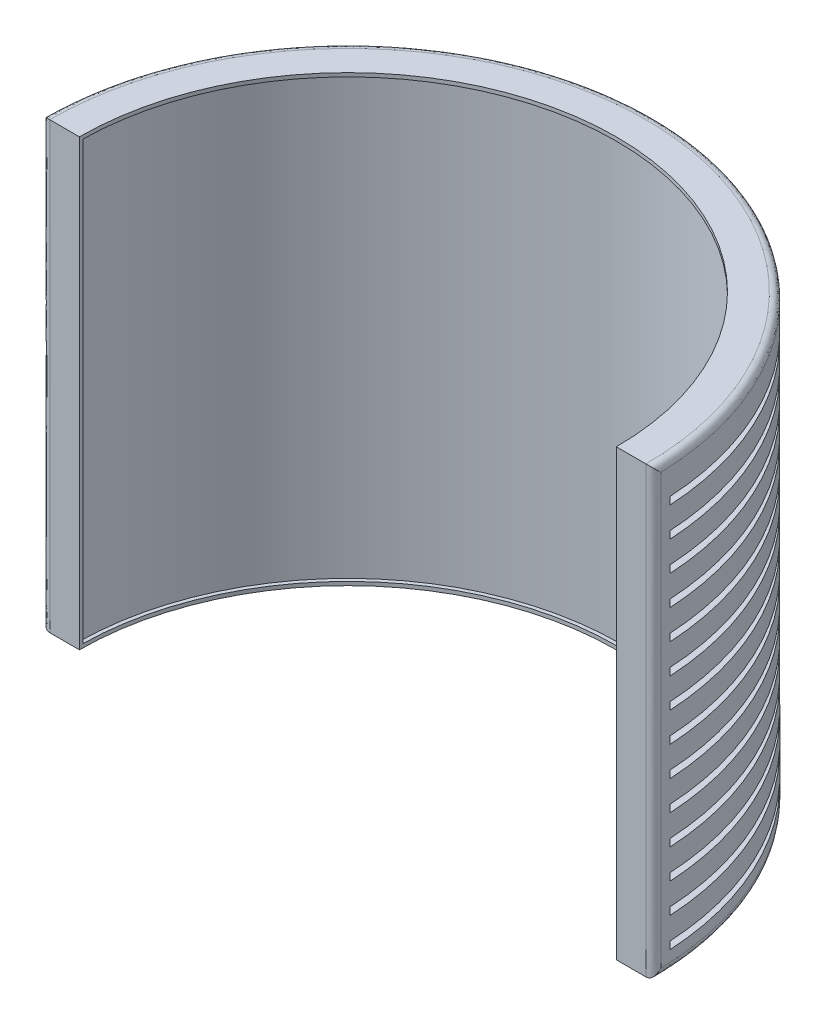
from build123d import *

# Parameters (mm, degrees)
BOSS_EXTRUDE1_DEPTH                     = 304.8
CUT_EXTRUDE1_DEPTH                      = 299.72
CUT_EXTRUDE2_DEPTH                      = 5.08
LPATTERN1_COUNT                         = 10
LPATTERN1_PITCH                         = 20.32
LPATTERN1_COUNT_DIR2                    = 10
LPATTERN1_PITCH_DIR2                    = 20.32
FILLET1_SIZE                            = 5.08
F_8_0_25_DIAMETER_HOLE1_D               = 6.35
F_8_0_25_DIAMETER_HOLE1_DEPTH           = 14.732
F_8_0_25_DIAMETER_HOLE1_TIP             = 1.907732465
F_8_0_25_DIAMETER_HOLE1_ON_FACE_2_D     = 6.35
F_8_0_25_DIAMETER_HOLE1_ON_FACE_2_DEPTH = 14.732
F_8_0_25_DIAMETER_HOLE1_ON_FACE_2_TIP   = 1.907732465


with BuildPart() as part:
    # Sketch1 → Boss-Extrude1 (new body)
    with BuildSketch(Plane(origin=(0, 0, 0), x_dir=(1, 0, 0), z_dir=(0, 1, 0))):
        with BuildLine():
            Line((-209.55, 0), (-184.15, 0))
            ThreePointArc((-184.15, 0), (0, 184.15), (184.15, 0))
            Line((184.15, 0), (209.55, 0))
            ThreePointArc((209.55, 0), (0, 209.55), (-209.55, 0))
        make_face()
    extrude(amount=-BOSS_EXTRUDE1_DEPTH)

    # Sketch5 → Cut-Extrude1 (cut)
    with BuildSketch(Plane(origin=(0, -2.54, 0), x_dir=(1, 0, 0), z_dir=(0, 1, 0))):
        with BuildLine():
            Line((-184.132481925, 2.54), (-186.672720289, 2.54))
            ThreePointArc((-186.672720289, 2.54), (0, 186.69), (186.672720289, 2.54))
            Line((186.672720289, 2.54), (184.132481925, 2.54))
            ThreePointArc((184.132481925, 2.54), (0, 184.15), (-184.132481925, 2.54))
        make_face()
    extrude(amount=-CUT_EXTRUDE1_DEPTH, mode=Mode.SUBTRACT)

    # Sketch9 → Cut-Extrude2 (cut)
    with BuildSketch(Plane(origin=(0, -22.86, 0), x_dir=(1, 0, 0), z_dir=(0, 1, 0))):
        with BuildLine():
            Line((-134.839981703, 150.312688202), (-140.285338085, 155.663825015))
            ThreePointArc((-140.285338085, 155.663825015), (-78.942662192, 194.111459183), (-8.177563934, 209.390376923))
            Line((-8.177563934, 209.390376923), (-8.111036028, 201.767033964))
            ThreePointArc((-8.111036028, 201.767033964), (-75.96470096, 187.096470058), (-134.839981703, 150.312688202))
        make_face()
        with BuildLine():
            Line((9.180878189, 201.721184747), (9.047636671, 209.354586218))
            ThreePointArc((9.047636671, 209.354586218), (79.748630782, 193.781728727), (140.931003892, 155.07951071))
            Line((140.931003892, 155.07951071), (135.635183246, 149.595527894))
            ThreePointArc((135.635183246, 149.595527894), (76.955792101, 186.691003967), (9.180878189, 201.721184747))
        make_face()
        with BuildLine():
            Line((147.936512687, 137.442763048), (153.191799923, 142.98068029))
            ThreePointArc((153.191799923, 142.98068029), (192.704155642, 82.318350922), (209.215767585, 11.830684413))
            Line((209.215767585, 11.830684413), (201.59474677, 11.63112096))
            ThreePointArc((201.59474677, 11.63112096), (185.742207523, 79.218414807), (147.936512687, 137.442763048))
        make_face()
        with BuildLine():
            Line((-201.530233216, 12.7), (-209.164797468, 12.7))
            ThreePointArc((-209.164797468, 12.7), (-192.360409314, 83.118442169), (-152.59630619, 143.616050069))
            Line((-152.59630619, 143.616050069), (-147.205583425, 138.225327304))
            ThreePointArc((-147.205583425, 138.225327304), (-185.319506261, 80.202278641), (-201.530233216, 12.7))
        make_face()
    cut_extrude2 = extrude(amount=-CUT_EXTRUDE2_DEPTH, mode=Mode.SUBTRACT)

    # LPattern1: Cut-Extrude2 10 × 10
    with Locations(*[Vector(0, -1, 0) * (i * LPATTERN1_PITCH) + Vector(0, -1, 0) * (j * LPATTERN1_PITCH_DIR2) for i in range(LPATTERN1_COUNT) for j in range(LPATTERN1_COUNT_DIR2) if (i, j) != (0, 0)]):
        add(cut_extrude2, mode=Mode.SUBTRACT)

    # Fillet1
    # a fillet whose section is not a circle: 5.08 mm, written as the material it takes off along each edge
    with BuildSketch(Plane(origin=(-209.55, 13.016532467, 0), x_dir=(0.012423318985848445, 0, -0.9999228275948979), z_dir=(0, -1, 0))) as fillet1_piece_1:
        with BuildLine():
            Bezier((5.206612987, 0), (-0.000803831, -0.064698393), (0.063894562, 5.142718425), weights=[1, 1, 1])
            Line((0.063894562, 5.142718425), (0, 0))
            ThreePointArc((0, 0), (2.603306493, -0.016171477), (5.206612987, 0))
        make_face()
    extrude(amount=330.833064935, mode=Mode.SUBTRACT)
    with BuildSketch(Plane(origin=(209.55, 13.016532467, 0), x_dir=(-1, 0, 0), z_dir=(0, -1, 0))) as fillet1_piece_2:
        with BuildLine():
            Bezier((5.143115331, 0), (-0.064703386, 0), (0.064683414, 5.20621118), weights=[1, 1, 1])
            ThreePointArc((0.064683414, 5.20621118), (0.016171477, 2.603306493), (0, 0))
            Line((0, 0), (5.143115331, 0))
        make_face()
    extrude(amount=330.833064935, mode=Mode.SUBTRACT)
    with BuildSketch(Plane(origin=(0, -304.8, 0), x_dir=(0.9981581066348997, 0, 0.060666252225040095), z_dir=(-0.060666252225040095, 0, 0.9981581066348997))) as fillet1_piece_3:
        with BuildLine():
            Bezier((209.55, FILLET1_SIZE), (209.55, 0), (209.55 - FILLET1_SIZE, 0), weights=[1, 1, 1])
            Line((209.55 - FILLET1_SIZE, 0), (209.55, 0))
            Line((209.55, 0), (209.55, FILLET1_SIZE))
        make_face()
    revolve(axis=Axis((0, -304.8, 0), (0, 1, 0)), revolution_arc=186.956111753, mode=Mode.SUBTRACT)
    with BuildSketch(Plane(origin=(0, 0, 0), x_dir=(0.9981581066348997, 0, 0.060666252225040095), z_dir=(-0.060666252225040095, 0, 0.9981581066348997))) as fillet1_piece_4:
        with BuildLine():
            Bezier((209.55, -FILLET1_SIZE), (209.55, 0), (209.55 - FILLET1_SIZE, 0), weights=[1, 1, 1])
            Line((209.55 - FILLET1_SIZE, 0), (209.55, 0))
            Line((209.55, 0), (209.55, -FILLET1_SIZE))
        make_face()
    revolve(axis=Axis((0, 0, 0), (0, 1, 0)), revolution_arc=186.956111753, mode=Mode.SUBTRACT)

    # #8 (0.25) Diameter Hole1
    with Locations(Plane(origin=(0.413838607, -292.129588944, -209.549591356), x_dir=(-0.999998049899, 0, -0.001974891947), z_dir=(0.001974891947, 0, -0.999998049899))):
        with Locations((0, 0)):
            Hole(F_8_0_25_DIAMETER_HOLE1_D / 2, depth=F_8_0_25_DIAMETER_HOLE1_DEPTH)
            with Locations((0, 0, -(F_8_0_25_DIAMETER_HOLE1_DEPTH + F_8_0_25_DIAMETER_HOLE1_TIP / 2))):  # 118° drill point
                Cone(0, F_8_0_25_DIAMETER_HOLE1_D / 2, F_8_0_25_DIAMETER_HOLE1_TIP, mode=Mode.SUBTRACT)

    # #8 (0.25) Diameter Hole1 on face 2
    with Locations(Plane(origin=(0.413838607, -254.029588944, -209.549591356), x_dir=(-0.999998049685, 0, -0.001975000098), z_dir=(0.001975000098, 0, -0.999998049685))):
        with Locations((0, 0)):
            Hole(F_8_0_25_DIAMETER_HOLE1_ON_FACE_2_D / 2, depth=F_8_0_25_DIAMETER_HOLE1_ON_FACE_2_DEPTH)
            with Locations((0, 0, -(F_8_0_25_DIAMETER_HOLE1_ON_FACE_2_DEPTH + F_8_0_25_DIAMETER_HOLE1_ON_FACE_2_TIP / 2))):  # 118° drill point
                Cone(0, F_8_0_25_DIAMETER_HOLE1_ON_FACE_2_D / 2, F_8_0_25_DIAMETER_HOLE1_ON_FACE_2_TIP, mode=Mode.SUBTRACT)


solid = part.part
